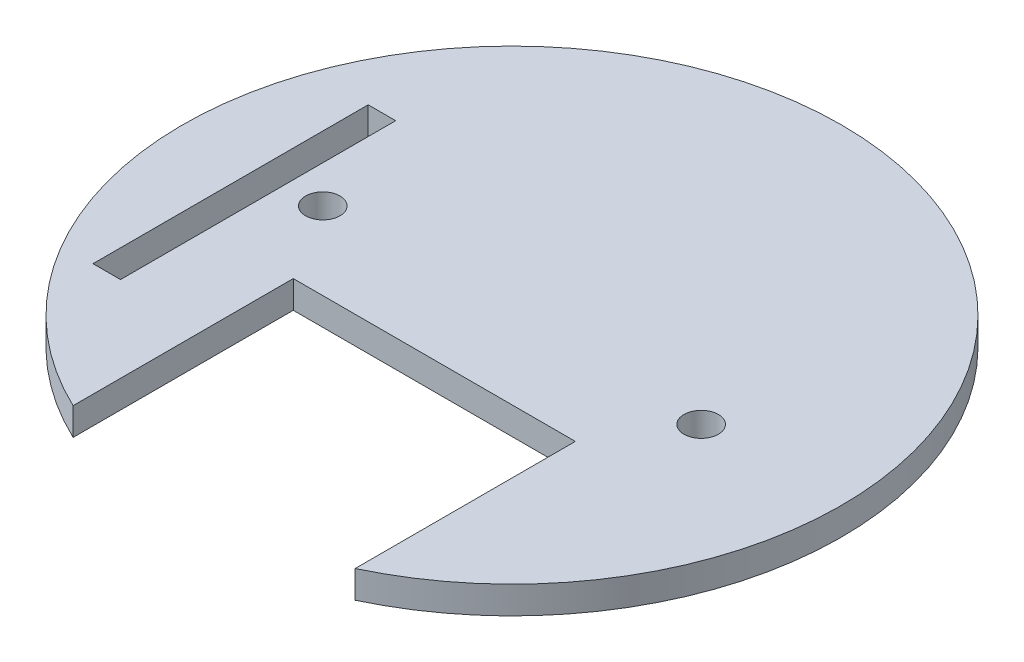
from build123d import *

# Parameters (mm, degrees)
SKETCH1_R           = 2.5
SKETCH1_W           = 4
SKETCH1_H           = 40
BOSS_EXTRUDE2_DEPTH = 4


with BuildPart() as part:
    # Sketch1 → Boss-Extrude2 (new body)
    with BuildSketch(Plane(origin=(0, 0, 0), x_dir=(1, 0, 0), z_dir=(0, 1, 0))):
        with BuildLine():
            Line((-20.5, -43.291569618), (-20.5, -11.291569618))
            Line((-20.5, -11.291569618), (20.5, -11.291569618))
            Line((20.5, -11.291569618), (20.5, -43.291569618))
            ThreePointArc((20.5, -43.291569618), (0, 47.9), (-20.5, -43.291569618))
        make_face()
        with Locations((-27.5, 0)):
            Circle(SKETCH1_R, mode=Mode.SUBTRACT)
        with Locations((27.5, 0)):
            Circle(SKETCH1_R, mode=Mode.SUBTRACT)
        with Locations((-34.928147447, -3.974885086)):
            Rectangle(SKETCH1_W, SKETCH1_H, mode=Mode.SUBTRACT)
    extrude(amount=BOSS_EXTRUDE2_DEPTH)


solid = part.part
